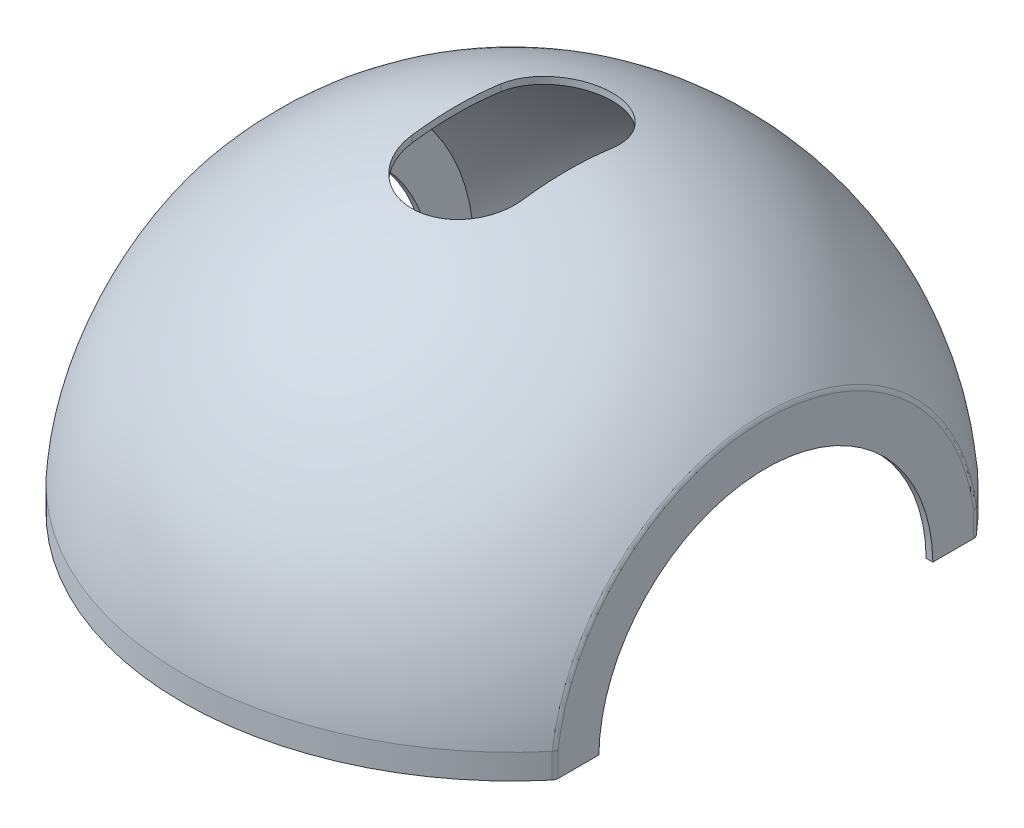
from build123d import *

# Parameters (mm, degrees)
ESQUISSE2_OUTSIDE_W     = 386.766
ESQUISSE2_OUTSIDE_H     = 238.266
ESQUISSE2_OUTSIDE_W_2   = 228
ESQUISSE2_OUTSIDE_H_2   = 155
ENL_V_MAT_EXTRU_1_DEPTH = 150
ENL_V_MAT_EXTRU_2_DEPTH = 239.646705404
BOSS_EXTRU_1_DEPTH      = 3
BOSS_EXTRU_2_START      = -3
BOSS_EXTRU_2_DEPTH      = 3
CONG_9_R                = 3


with BuildPart() as part:
    # Esquisse1 → Révolution4 (revolve)
    with BuildSketch(Plane.XY, mode=Mode.PRIVATE) as r_volution4_sk:
        with BuildLine():
            Line((148, 12.175795662), (148, 1))
            Line((148, 1), (145, 1))
            Line((145, 1), (145, 12.051970793))
            ThreePointArc((145, 12.051970793), (98.530929788, 107.060290842), (0, 145.5))
            Line((0, 145.5), (0, 148.5))
            ThreePointArc((0, 148.5), (100.608509442, 109.225353412), (148, 12.175795662))
        make_face()
    revolve(r_volution4_sk.sketch.rotate(Axis((0, 0, 0), (0, 1, 0)), 90), axis=Axis((0, 0, 0), (0, 1, 0)))

    # Esquisse2 outside → Enlèv. mat.-Extru.1 (cut, symmetric)
    with BuildSketch(Plane.XY):
        with Locations((0, 74.75)):
            Rectangle(ESQUISSE2_OUTSIDE_W, ESQUISSE2_OUTSIDE_H)
        with Locations((0, 72.5)):
            Rectangle(ESQUISSE2_OUTSIDE_W_2, ESQUISSE2_OUTSIDE_H_2, mode=Mode.SUBTRACT)
    extrude(amount=ENL_V_MAT_EXTRU_1_DEPTH, both=True, mode=Mode.SUBTRACT)

    # Esquisse3 → Enlèv. mat.-Extru.2 (cut, through all)
    with BuildSketch(Plane(origin=(0, 0, 0), x_dir=(1, 0, 0), z_dir=(0, 1, 0))):
        with BuildLine():
            Line((-25, -20), (-25, 20))
            ThreePointArc((-25, 20), (0, 45), (25, 20))
            Line((25, 20), (25, -20))
            ThreePointArc((25, -20), (0, -45), (-25, -20))
        make_face()
    extrude(amount=ENL_V_MAT_EXTRU_2_DEPTH, mode=Mode.SUBTRACT)

    # Esquisse4 → Boss.-Extru.1 (add)
    with BuildSketch(Plane(origin=(114, 0, 0), x_dir=(0, 0, -1), z_dir=(1, 0, 0))):
        with BuildLine():
            Line((-93.994680701, 1), (-74.993333037, 1))
            ThreePointArc((-74.993333037, 1), (0, 75), (74.993333037, 1))
            Line((74.993333037, 1), (93.994680701, 1))
            ThreePointArc((93.994680701, 1), (0, 94), (-93.994680701, 1))
        make_face()
    extrude(amount=-BOSS_EXTRU_1_DEPTH)

    # Esquisse5 → Boss.-Extru.2 (add)
    with BuildSketch(Plane.ZY.offset(114).offset(BOSS_EXTRU_2_START)):
        with BuildLine():
            Line((-93.994680701, 1), (-74.993333037, 1))
            ThreePointArc((-74.993333037, 1), (0, 75), (74.993333037, 1))
            Line((74.993333037, 1), (93.994680701, 1))
            ThreePointArc((93.994680701, 1), (0, 94), (-93.994680701, 1))
        make_face()
    extrude(amount=BOSS_EXTRU_2_DEPTH)

    # Congé9
    # the kernel refuses this fillet: 3 mm, written as the material it takes off along each edge
    with BuildSketch(Plane(origin=(-114, 20.411983352, -94.382201712), x_dir=(0.6405708887604551, 0, -0.767899040546764), z_dir=(0, -1, 0)), Plane(origin=(114, 20.411983352, 94.382201712), x_dir=(-0.6405708887604538, 0, 0.7678990405467649), z_dir=(0, -1, 0))) as cong_9_piece_1:
        with BuildLine():
            CenterArc((1.087028375, 2.999979354), CONG_9_R, 230.165597581, 40.046969931)
            Line((-0.834684291, 0.696282232), (0, 0))
            ThreePointArc((0, 0), (0.549079179, -0.001018544), (1.098158359, 0))
        make_face()
    extrude(amount=22.157379249, mode=Mode.SUBTRACT)
    with BuildSketch(Plane(origin=(-114, 0, 0), x_dir=(0, 0.09906318090270165, -0.9950811455300712), z_dir=(0, -0.9950811455300712, -0.09906318090270165))) as cong_9_piece_2:
        with BuildLine():
            CenterArc((94.070452322, 3), CONG_9_R, 270, 40.28066089)
            ThreePointArc((96.010049277, 0.711340206), (95.587852119, 0.354883399), (95.164331553, 0))
            Line((95.164331553, 0), (94.070452322, 0))
        make_face()
    revolve(axis=Axis((-114, 0, 0), (1, 0, 0)), revolution_arc=168.629546335, mode=Mode.SUBTRACT)
    with BuildSketch(Plane(origin=(-114, 20.411983352, 94.382201712), x_dir=(0, 0, -1), z_dir=(0, -1, 0))) as cong_9_piece_3:
        with BuildLine():
            CenterArc((1.086971394, 3), CONG_9_R, 229.953030069, 40.046969931)
            ThreePointArc((-0.84327475, 0.703448276), (-0.422289825, 0.350941999), (0, 0))
            Line((0, 0), (1.086971394, 0))
        make_face()
    extrude(amount=22.157379249, mode=Mode.SUBTRACT)
    with BuildSketch(Plane(origin=(114, 0, 0), x_dir=(0, 0.09906318090270108, 0.9950811455300712), z_dir=(0, -0.9950811455300712, 0.09906318090270108))) as cong_9_piece_4:
        with BuildLine():
            CenterArc((94.070452322, 3), CONG_9_R, 270, 40.28066089)
            Line((94.070452322, 0), (95.164331553, 0))
            ThreePointArc((95.164331553, 0), (95.587852119, 0.354883399), (96.010049277, 0.711340206))
        make_face()
    revolve(axis=Axis((114, 0, 0), (-1, 0, 0)), revolution_arc=168.629546335, mode=Mode.SUBTRACT)
    with BuildSketch(Plane(origin=(114, 20.411983352, -94.382201712), x_dir=(-0.6405708887604424, 0, -0.7678990405467746), z_dir=(0, -1, 0))) as cong_9_piece_5:
        with BuildLine():
            CenterArc((1.087028375, -2.999979354), CONG_9_R, 89.787432488, 40.046969931)
            Line((-0.834684291, -0.696282232), (0, 0))
            ThreePointArc((0, 0), (0.549079179, 0.001018544), (1.098158359, 0))
        make_face()
    extrude(amount=22.157379249, mode=Mode.SUBTRACT)


solid = part.part
